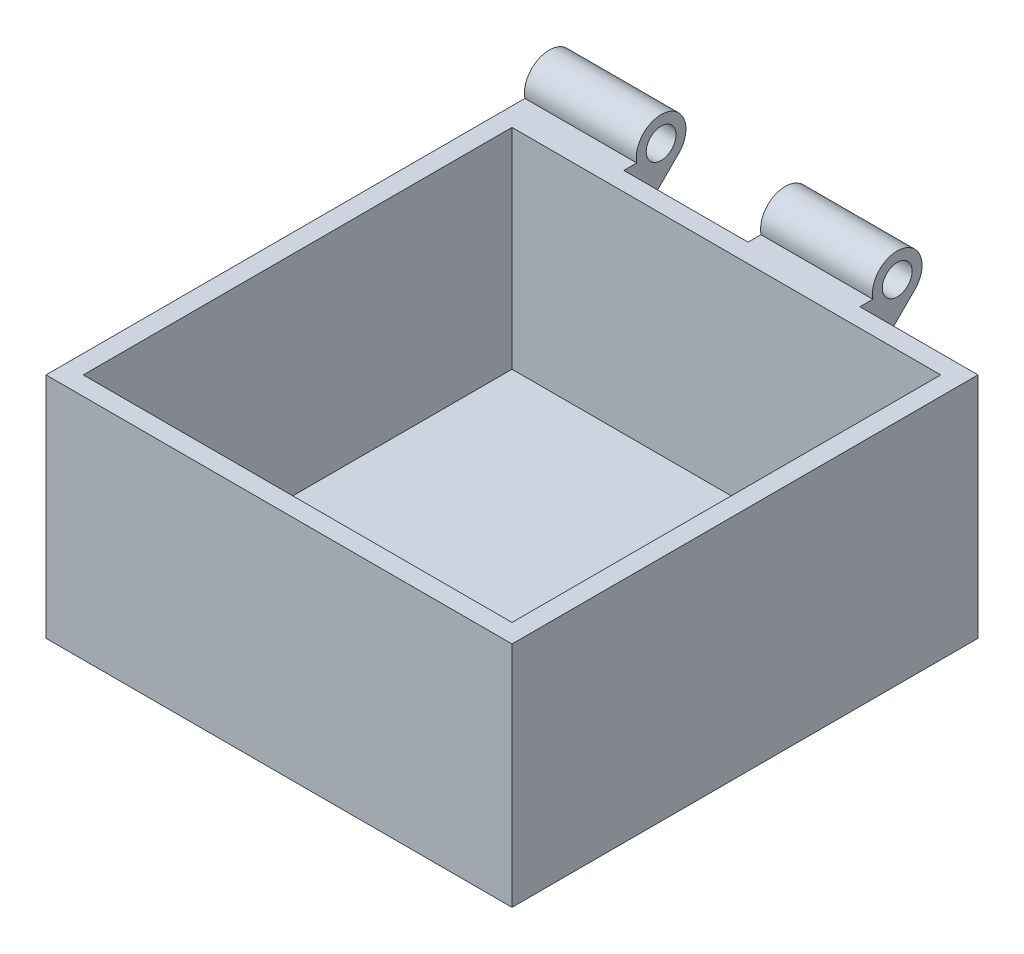
from build123d import *

# Parameters (mm, degrees)
SKETCH1_W           = 95.25
SKETCH1_H           = 95.25
BOSS_EXTRUDE1_DEPTH = 47.625
SHELL1_T            = -3.81
SKETCH2_R           = 3.048
BOSS_EXTRUDE2_DEPTH = 22.86
BOSS_EXTRUDE3_START = -46.99
SKETCH5_R           = 3.048
BOSS_EXTRUDE3_DEPTH = 22.86
SKETCH2_3_W         = 95.25
SKETCH2_3_H         = 1.000000032
CUT_EXTRUDE1_DEPTH  = 125.456760162


with BuildPart() as part:
    # Sketch1 → Boss-Extrude1 (new body)
    with BuildSketch(Plane(origin=(0, 0, 0), x_dir=(1, 0, 0), z_dir=(0, 1, 0))):
        Rectangle(SKETCH1_W, SKETCH1_H)
    extrude(amount=BOSS_EXTRUDE1_DEPTH)

    # Shell1
    shell1_openings = [part.faces().sort_by_distance(p)[0] for p in [
        (0, 47.625, 0),
    ]]
    offset(amount=SHELL1_T, openings=shell1_openings, kind=Kind.INTERSECTION)

    # Sketch2 → Boss-Extrude2 (add)
    with BuildSketch(Plane.ZY.offset(47.625)):
        with BuildLine():
            ThreePointArc((-50.165, 47.625), (-57.189031836, 52.318308025), (-58.837102448, 44.032897552))
            Line((-58.837102448, 44.032897552), (-47.625, 32.820795103))
            Line((-47.625, 32.820795103), (-47.625, 46.624999968))
            Line((-47.625, 46.624999968), (-50.264397633, 46.624999968))
            ThreePointArc((-50.264397633, 46.624999968), (-50.189910484, 47.122536083), (-50.165, 47.625))
        make_face()
        with Locations((-55.245, 47.625)):
            Circle(SKETCH2_R, mode=Mode.SUBTRACT)
    extrude(amount=-BOSS_EXTRUDE2_DEPTH)

    # Sketch5 → Boss-Extrude3 (add)
    with BuildSketch(Plane(origin=(47.625, 0, 0), x_dir=(0, 0, -1), z_dir=(1, 0, 0)).offset(BOSS_EXTRUDE3_START)):
        with BuildLine():
            Line((47.625, 46.624999968), (47.625, 32.820795103))
            Line((47.625, 32.820795103), (58.837102448, 44.032897552))
            ThreePointArc((58.837102448, 44.032897552), (56.715282878, 52.487578355), (50.264397633, 46.624999968))
            Line((50.264397633, 46.624999968), (47.625, 46.624999968))
        make_face()
        with Locations((55.245, 47.625)):
            Circle(SKETCH5_R, mode=Mode.SUBTRACT)
    extrude(amount=BOSS_EXTRUDE3_DEPTH)

    # Sketch2<3> → Cut-Extrude1 (cut, through all)
    with BuildSketch(Plane.ZY.offset(47.625)):
        with Locations((0, 47.124999984)):
            Rectangle(SKETCH2_3_W, SKETCH2_3_H)
    extrude(amount=-CUT_EXTRUDE1_DEPTH, mode=Mode.SUBTRACT)


solid = part.part
